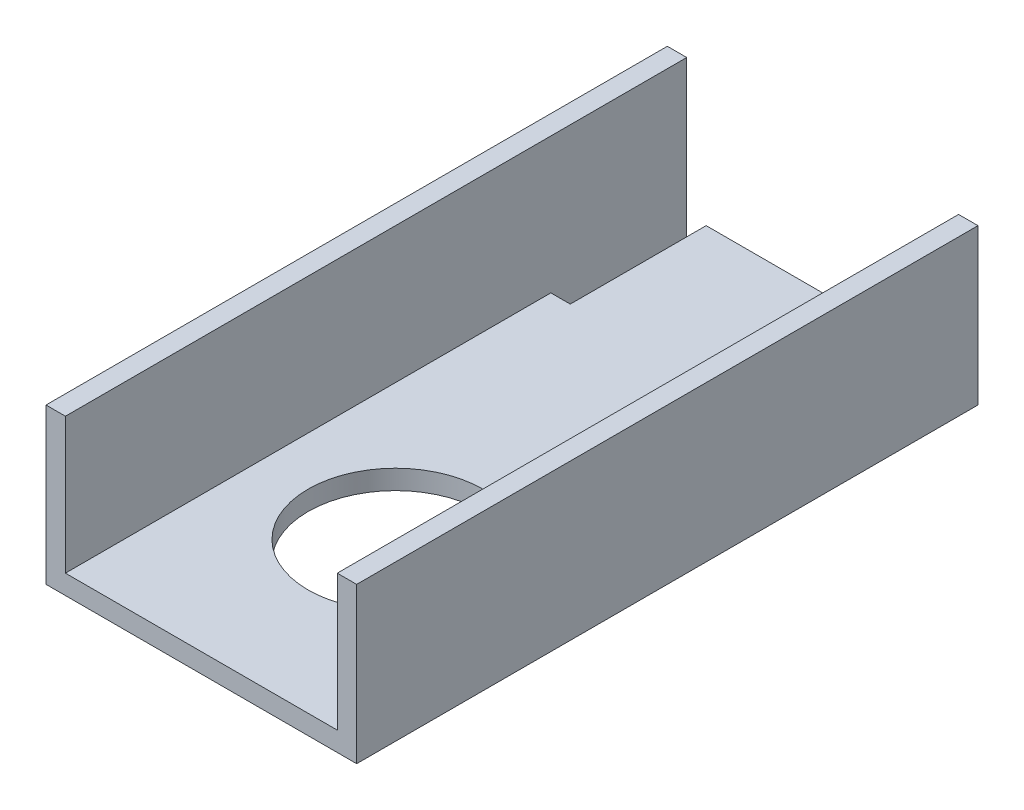
from build123d import *

# Parameters (mm, degrees)
BOSS_EXTRUDE1_DEPTH = 101.6
CUT_EXTRUDE1_REACH  = 118.397
SKETCH2_R           = 14.2875
CUT_EXTRUDE2_REACH  = 117.746
SKETCH3_W           = 3.175
SKETCH3_H           = 22.225


with BuildPart() as part:
    # Sketch1 → Boss-Extrude1 (new body)
    with BuildSketch(Plane.XY):
        Polygon((47.625, 3.175), (47.625, 25.4), (50.8, 25.4), (50.8, 0), (0, 0), (0, 25.4), (3.175, 25.4), (3.175, 3.175), align=None)
    extrude(amount=BOSS_EXTRUDE1_DEPTH)

    # Sketch2 → Cut-Extrude1 (cut, up to next)
    with BuildSketch(Plane.XZ, mode=Mode.PRIVATE) as cut_extrude1_sk1:
        with Locations((25.4, 69.85)):
            Circle(SKETCH2_R)
    cut_extrude1_tool1 = extrude(cut_extrude1_sk1.sketch, amount=-CUT_EXTRUDE1_REACH, mode=Mode.PRIVATE) & part.part
    add(cut_extrude1_tool1.solids().sort_by_distance((25.4, 0, 69.85))[0], mode=Mode.SUBTRACT)

    # Sketch3 → Cut-Extrude2 (cut, up to next)
    with BuildSketch(Plane(origin=(0, 3.175, 0), x_dir=(1, 0, 0), z_dir=(0, 1, 0)), mode=Mode.PRIVATE) as cut_extrude2_sk1:
        with Locations((4.7625, -11.1125)):
            Rectangle(SKETCH3_W, SKETCH3_H)
    cut_extrude2_tool1 = extrude(cut_extrude2_sk1.sketch, amount=-CUT_EXTRUDE2_REACH, mode=Mode.PRIVATE) & part.part
    add(cut_extrude2_tool1.solids().sort_by_distance((4.7625, 3.175, 11.1125))[0], mode=Mode.SUBTRACT)


solid = part.part
